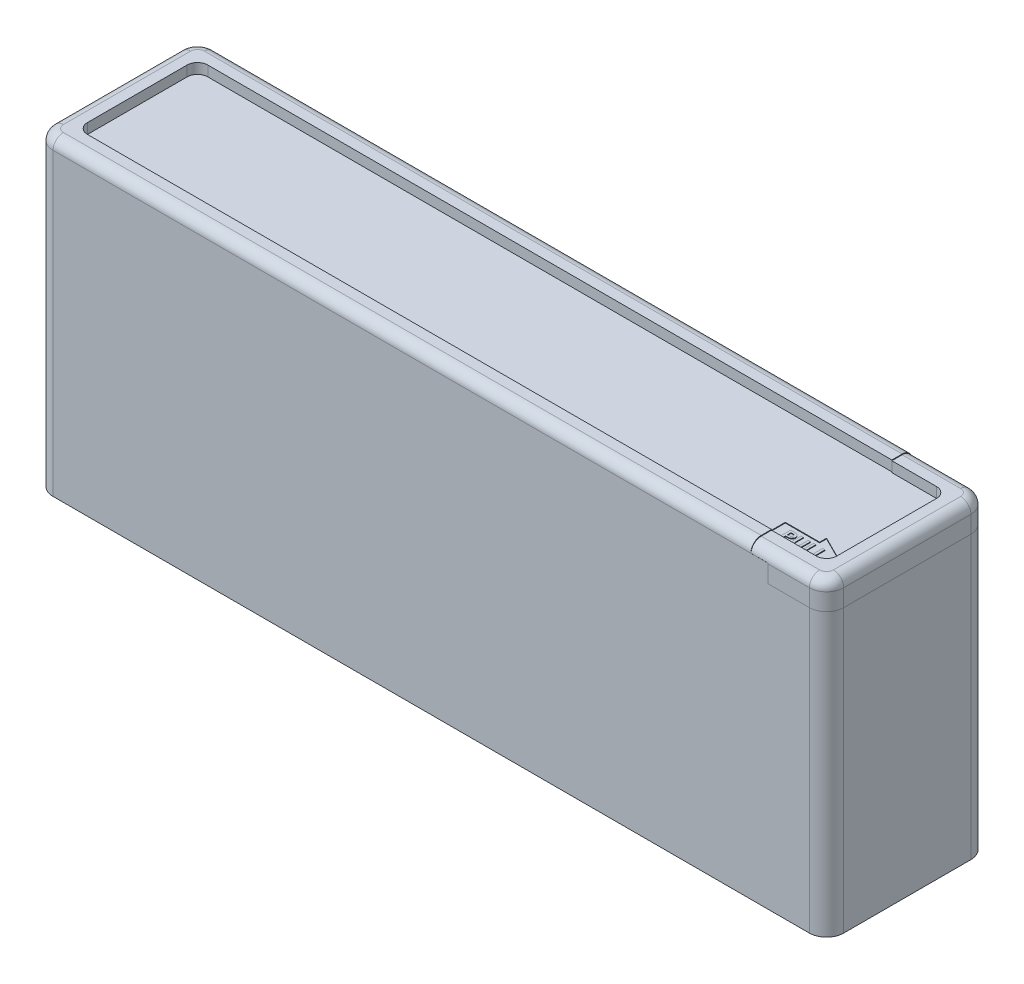
from build123d import *

# Parameters (mm, degrees)
SKETCH1_W              = 214
SKETCH1_H              = 47
SKETCH1_W_2            = 202
SKETCH1_H_2            = 35
BOSS_EXTRUDE1_DEPTH    = 5
SKETCH2_W              = 214
SKETCH2_H              = 47
BOSS_EXTRUDE2_DEPTH    = 2
BOSS_EXTRUDE3_DEPTH    = 202
SKETCH4_W              = 214
SKETCH4_H              = 47
SKETCH4_W_2            = 202
SKETCH4_H_2            = 35
BOSS_EXTRUDE4_DEPTH    = 45
SKETCH6_W              = 47
SKETCH6_H              = 52
BOSS_EXTRUDE5_DEPTH    = 16
SKETCH7_W              = 5
SKETCH7_H              = 41
CUT_EXTRUDE1_DEPTH     = 50.1
SKETCH8_W              = 41
SKETCH8_H              = 50
BOSS_EXTRUDE6_DEPTH    = 5
SKETCH9_W              = 41
SKETCH9_H              = 50.1
CUT_EXTRUDE2_DEPTH     = 14
SKETCH10_W             = 41
SKETCH10_H             = 50
BOSS_EXTRUDE7_DEPTH    = 3
SKETCH12_W             = 41
SKETCH12_H             = 50
SKETCH12_W_2           = 35
SKETCH12_H_2           = 44
BOSS_EXTRUDE8_DEPTH    = 11
CHAMFER1_SIZE          = 8
FILLET1_R              = 3
FILLET2_R              = 3
FILLET3_R              = 3
SKETCH15_R             = 1.1
CUT_EXTRUDE3_DEPTH     = 11
CUT_EXTRUDE4_DEPTH     = 2.2
SKETCH17_R             = 1
SKETCH17_R_2           = 1.1
CUT_EXTRUDE5_DEPTH     = 5
BOSS_EXTRUDE9_DEPTH    = 5.2
FILLET4_R              = 3
BOSS_EXTRUDE10_DEPTH   = 3
FILLET5_R              = 3
FILLET6_R              = 5
FILLET7_R              = 3
BOSS_EXTRUDE11_DEPTH   = 5
BOSS_EXTRUDE12_DEPTH   = 3
FILLET8_R              = 3
BOSS_EXTRUDE13_DEPTH   = 30
SKETCH24_R             = 6.05
CUT_EXTRUDE6_DEPTH     = 1.5
SKETCH25_W             = 80.4
SKETCH25_H             = 30.3
CUT_EXTRUDE7_DEPTH     = 25.1
CUT_EXTRUDE8_DEPTH     = 3
BOSS_EXTRUDE14_DEPTH   = 1
SKETCH28_R             = 7.5
CUT_EXTRUDE9_DEPTH     = 2
FILLET10_R             = 5
SKETCH29_W             = 65.3
SKETCH29_H             = 30.3
CUT_EXTRUDE10_DEPTH    = 15
SKETCH30_R             = 4.05
CUT_EXTRUDE11_DEPTH    = 2.8
SKETCH31_R             = 4.05
BOSS_EXTRUDE15_DEPTH   = 1
BOSS_EXTRUDE15_2_DEPTH = 1
SKETCH32_W             = 65.1
SKETCH32_H             = 30.1
BOSS_EXTRUDE16_DEPTH   = 15
SHELL1_T               = -3
SKETCH34_R             = 4.05
CUT_EXTRUDE12_DEPTH    = 2
CUT_EXTRUDE13_DEPTH    = 2
FILLET11_R             = 5
CUT_EXTRUDE14_DEPTH    = 0.2
BOSS_EXTRUDE17_DEPTH   = 0.2
BOSS_EXTRUDE18_DEPTH   = 2
SKETCH39_R             = 4
BOSS_EXTRUDE19_DEPTH   = 1.65
BOSS_EXTRUDE19_2_DEPTH = 1.65
SKETCH40_R             = 6
BOSS_EXTRUDE20_DEPTH   = 2.5
BOSS_EXTRUDE20_2_DEPTH = 2.5
BOSS_EXTRUDE20_3_DEPTH = 2.5
BOSS_EXTRUDE20_4_DEPTH = 2.5


# Some blends are built 0.0001 mm under size
with BuildPart() as part:
    # Sketch1 → Boss-Extrude1 (new body)
    with BuildSketch(Plane(origin=(0, 0, 0), x_dir=(1, 0, 0), z_dir=(0, 1, 0))):
        with Locations((101, 17.5)):
            Rectangle(SKETCH1_W, SKETCH1_H)
        with Locations((101, 17.5)):
            Rectangle(SKETCH1_W_2, SKETCH1_H_2, mode=Mode.SUBTRACT)
    extrude(amount=BOSS_EXTRUDE1_DEPTH)

    # Sketch2 → Boss-Extrude2 (add)
    with BuildSketch(Plane.XZ):
        with Locations((101, -17.5)):
            Rectangle(SKETCH2_W, SKETCH2_H)
    extrude(amount=BOSS_EXTRUDE2_DEPTH)

    # Sketch3 → Boss-Extrude3 (add)
    with BuildSketch(Plane(origin=(0, 0, 0), x_dir=(0, 0, -1), z_dir=(1, 0, 0))):
        with BuildLine():
            Line((13.5, 0), (21.5, 0))
            ThreePointArc((21.5, 0), (17.5, 1), (13.5, 0))
        make_face()
    extrude(amount=BOSS_EXTRUDE3_DEPTH)

    # Sketch4 → Boss-Extrude4 (add)
    with BuildSketch(Plane(origin=(0, 5, 0), x_dir=(1, 0, 0), z_dir=(0, 1, 0))):
        with Locations((101, 17.5)):
            Rectangle(SKETCH4_W, SKETCH4_H)
        with Locations((101, 17.5)):
            Rectangle(SKETCH4_W_2, SKETCH4_H_2, mode=Mode.SUBTRACT)
    extrude(amount=BOSS_EXTRUDE4_DEPTH)

    # Sketch6 → Boss-Extrude5 (add)
    with BuildSketch(Plane(origin=(208, 0, 0), x_dir=(0, 0, -1), z_dir=(1, 0, 0))):
        with Locations((17.5, 24)):
            Rectangle(SKETCH6_W, SKETCH6_H)
    extrude(amount=BOSS_EXTRUDE5_DEPTH)

    # Sketch7 → Cut-Extrude1 (cut)
    with BuildSketch(Plane(origin=(0, 50, 0), x_dir=(1, 0, 0), z_dir=(0, 1, 0))):
        with Locations((204.5, 17.5)):
            Rectangle(SKETCH7_W, SKETCH7_H)
    extrude(amount=-CUT_EXTRUDE1_DEPTH, mode=Mode.SUBTRACT)

    # Sketch9 → Cut-Extrude2 (cut)
    with BuildSketch(Plane.ZY.offset(-207)):
        with Locations((-17.5, 24.95)):
            Rectangle(SKETCH9_W, SKETCH9_H)
    extrude(amount=-CUT_EXTRUDE2_DEPTH, mode=Mode.SUBTRACT)

    # Fillet1
    fillet1_edges = [part.edges().sort_by_distance(p)[0] for p in [
        (221, 24.95, 3),
        (221, -0.1, -17.5),
        (221, 24.95, -38),
        (211.5, -0.1, 3),
        (211.5, -0.1, -38),
    ]]
    fillet(fillet1_edges, radius=FILLET1_R)

    # Sketch18 → Boss-Extrude9 (add)
    with BuildSketch(Plane(origin=(0, 50, 0), x_dir=(1, 0, 0), z_dir=(0, 1, 0))):
        Polygon((-6, -6), (207, -6), (207, -3.2), (-3.2, -3.2), (-3.2, 38.2), (207, 38.2), (207, 41), (-6, 41), align=None)
    extrude(amount=BOSS_EXTRUDE9_DEPTH)

    # Fillet4
    # the kernel refuses this fillet: 3 mm, written as the material it takes off along each edge
    with BuildSketch(Plane(origin=(207, 50, 3.2), x_dir=(-1, 0, 0), z_dir=(0, 1, 0))) as fillet4_piece_1:
        with BuildLine():
            CenterArc((2.993325909, 3), FILLET4_R, 183.822553729, 86.177446271)
            Line((0, 2.8), (-0.059866518, 2.796))
            ThreePointArc((-0.059866518, 2.796), (-0.06, 1.4), (-0.06, 0))
            Line((-0.06, 0), (0, -0.06))
            Line((0, -0.06), (2.993325909, -0.06))
            Line((2.993325909, -0.06), (2.993325909, 0))
        make_face()
    extrude(amount=12.683314774, mode=Mode.SUBTRACT)
    with BuildSketch(Plane(origin=(207, 50, -38.2), x_dir=(0, 0, -1), z_dir=(0, 1, 0))) as fillet4_piece_2:
        with BuildLine():
            CenterArc((3, 2.993325909), FILLET4_R, 180, 86.177446271)
            Line((0, 2.993325909), (-0.06, 2.993325909))
            Line((-0.06, 2.993325909), (-0.06, 0))
            Line((-0.06, 0), (0, -0.06))
            ThreePointArc((0, -0.06), (1.4, -0.06), (2.796, -0.059866518))
            Line((2.796, -0.059866518), (2.8, 0))
        make_face()
    extrude(amount=12.683314774, mode=Mode.SUBTRACT)

    # Sketch19 → Boss-Extrude10 (add)
    with BuildSketch(Plane(origin=(0, 55.2, 0), x_dir=(1, 0, 0), z_dir=(0, 1, 0))):
        Polygon((0, 0), (202, 0), (202, -6), (-6, -6), (-6, 41), (202, 41), (202, 35), (0, 35), align=None)
    extrude(amount=BOSS_EXTRUDE10_DEPTH)

    # Fillet5
    fillet5_edges = [part.edges().sort_by_distance(p)[0] for p in [
        (-3.2, 52.6, 3.2),
        (-3.2, 52.6, -38.2),
        (0, 56.7, 0),
        (0, 56.7, -35),
    ]]
    fillet(fillet5_edges, radius=FILLET5_R)

    # Fillet6
    fillet6_edges = [part.edges().sort_by_distance(p)[0] for p in [
        (224, 24, 6),
        (224, 24, -41),
        (-6, 28.1, -41),
        (-6, 28.1, 6),
    ]]
    fillet(fillet6_edges, radius=FILLET6_R)

    # Fillet7
    fillet7_edges = [part.edges().sort_by_distance(p)[0] for p in [
        (100.5, 58.2, -41),
        (-4.535533906, 58.2, -39.535533906),
        (-6, 58.2, -17.5),
        (-4.535533906, 58.2, 4.535533906),
        (100.5, 58.2, 6),
    ]]
    fillet(fillet7_edges, radius=FILLET7_R)

    # Sketch23 → Boss-Extrude13 (add)
    with BuildSketch(Plane.XZ.offset(2)):
        with BuildLine():
            Line((224, -36), (224, 1))
            ThreePointArc((224, 1), (222.535533906, 4.535533906), (219, 6))
            Line((219, 6), (-1, 6))
            ThreePointArc((-1, 6), (-4.535533906, 4.535533906), (-6, 1))
            Line((-6, 1), (-6, -36))
            ThreePointArc((-6, -36), (-4.535533906, -39.535533906), (-1, -41))
            Line((-1, -41), (219, -41))
            ThreePointArc((219, -41), (222.535533906, -39.535533906), (224, -36))
        make_face()
    extrude(amount=BOSS_EXTRUDE13_DEPTH)

    # Sketch24 → Cut-Extrude6 (cut)
    with BuildSketch(Plane.XZ.offset(32)):
        with Locations(Location((4, -4, 0), (0, 0, 270))):
            Circle(SKETCH24_R)
        with Locations(Location((4, -31, 0), (0, 0, 270))):
            Circle(SKETCH24_R)
        with Locations(Location((214, -31, 0), (0, 0, 270))):
            Circle(SKETCH24_R)
        with Locations(Location((214, -4, 0), (0, 0, 270))):
            Circle(SKETCH24_R)
    extrude(amount=-CUT_EXTRUDE6_DEPTH, mode=Mode.SUBTRACT)

    # Sketch25 → Cut-Extrude7 (cut)
    with BuildSketch(Plane.XZ.offset(32)):
        with Locations((74.2, -17.5)):
            Rectangle(SKETCH25_W, SKETCH25_H)
    extrude(amount=-CUT_EXTRUDE7_DEPTH, mode=Mode.SUBTRACT)

    # Sketch26 → Cut-Extrude8 (cut)
    with BuildSketch(Plane.XZ.offset(6.9)):
        with BuildLine():
            Line((76.75, -7.4), (71.65, -7.4))
            ThreePointArc((71.65, -7.4), (71.296446609, -7.546446609), (71.15, -7.9))
            Line((71.15, -7.9), (71.15, -27.1))
            ThreePointArc((71.15, -27.1), (71.296446609, -27.453553391), (71.65, -27.6))
            Line((71.65, -27.6), (76.75, -27.6))
            ThreePointArc((76.75, -27.6), (77.103553391, -27.453553391), (77.25, -27.1))
            Line((77.25, -27.1), (77.25, -7.9))
            ThreePointArc((77.25, -7.9), (77.103553391, -7.546446609), (76.75, -7.4))
        make_face()
    extrude(amount=-CUT_EXTRUDE8_DEPTH, mode=Mode.SUBTRACT)

    # Sketch28 → Cut-Extrude9 (cut)
    with BuildSketch(Plane.XZ.offset(32)):
        with Locations((36, -17.5)):
            Circle(SKETCH28_R)
        with Locations((112.4, -17.5)):
            Circle(SKETCH28_R)
    extrude(amount=-CUT_EXTRUDE9_DEPTH, mode=Mode.SUBTRACT)

    # Fillet10
    # the kernel refuses this fillet: 5 mm, written as the material it adds along each edge
    with BuildSketch(Plane(origin=(112.4, -30, -17.5), x_dir=(-0.8747262427675082, 0, 0.484617375063914), z_dir=(-0.484617375063914, 0, -0.8747262427675082))) as fillet10_piece_1_section:
        with BuildLine():
            CenterArc((3.5, -5), FILLET10_R, 36.869897646, 53.130102354)
            Line((3.5, 0), (3.5, 0.1))
            Line((3.5, 0.1), (7.5, 0.1))
            Line((7.5, 0.1), (7.6, 0))
            ThreePointArc((7.6, 0), (7.6, -1), (7.58, -1.94))
            Line((7.58, -1.94), (7.5, -2))
        make_face()
    fillet10_piece_1 = revolve(axis=Axis((112.4, -30, -17.5), (0, 1, 0)), revolution_arc=302.025186185, mode=Mode.PRIVATE)
    fillet10_piece_1 = split(fillet10_piece_1, bisect_by=Plane(origin=(114.4, -30, -17.5), z_dir=(1, 0, 0)), keep=Keep.TOP, mode=Mode.PRIVATE)
    add(fillet10_piece_1)
    with BuildSketch(Plane(origin=(36, -30, -17.5), x_dir=(0.8747262427675081, 0, 0.48461737506391406), z_dir=(0.48461737506391406, 0, -0.8747262427675081))) as fillet10_piece_2_section:
        with BuildLine():
            CenterArc((3.5, 5), FILLET10_R, 270, 53.130102354)
            Line((3.5, 0), (3.5, -0.1))
            Line((3.5, -0.1), (7.5, -0.1))
            Line((7.5, -0.1), (7.6, 0))
            ThreePointArc((7.6, 0), (7.6, 1), (7.58, 1.94))
            Line((7.58, 1.94), (7.5, 2))
        make_face()
    fillet10_piece_2 = revolve(axis=Axis((36, -30, -17.5), (0, -1, 0)), revolution_arc=302.025186185, mode=Mode.PRIVATE)
    fillet10_piece_2 = split(fillet10_piece_2, bisect_by=Plane(origin=(34, -30, -17.5), z_dir=(-1, 0, 0)), keep=Keep.TOP, mode=Mode.PRIVATE)
    add(fillet10_piece_2)

    # Sketch29 → Cut-Extrude10 (cut)
    with BuildSketch(Plane.XZ.offset(32)):
        with Locations((167.35, -17.5)):
            Rectangle(SKETCH29_W, SKETCH29_H)
    extrude(amount=-CUT_EXTRUDE10_DEPTH, mode=Mode.SUBTRACT)

    # Sketch30 → Cut-Extrude11 (cut)
    with BuildSketch(Plane.XZ.offset(17)):
        with Locations(Location((140.7, -17.5, 0), (0, 0, 270))):
            Circle(SKETCH30_R)
        with Locations(Location((194, -17.5, 0), (0, 0, 270))):
            Circle(SKETCH30_R)
    extrude(amount=-CUT_EXTRUDE11_DEPTH, mode=Mode.SUBTRACT)

    # Sketch35 → Cut-Extrude13 (cut)
    with BuildSketch(Plane.XZ.offset(32)):
        with BuildLine():
            Line((200, -24.728416147), (200, -10.271583853))
            ThreePointArc((200, -10.271583853), (205.5, -17.5), (200, -24.728416147))
        make_face()
        with BuildLine():
            Line((134.7, -10.271583853), (134.7, -24.728416147))
            ThreePointArc((134.7, -24.728416147), (129.2, -17.5), (134.7, -10.271583853))
        make_face()
    extrude(amount=-CUT_EXTRUDE13_DEPTH, mode=Mode.SUBTRACT)

    # Fillet11
    # the kernel refuses this fillet: 5 mm, written as the material it adds along each edge
    with BuildSketch(Plane(origin=(198, -30, -17.5), x_dir=(-0.8747262427675054, 0, 0.48461737506391894), z_dir=(-0.48461737506391894, 0, -0.8747262427675054))) as fillet11_piece_1_section:
        with BuildLine():
            CenterArc((3.5, -5), FILLET11_R, 36.869897646, 53.130102354)
            Line((3.5, 0), (3.5, 0.1))
            Line((3.5, 0.1), (7.5, 0.1))
            Line((7.5, 0.1), (7.6, 0))
            ThreePointArc((7.6, 0), (7.6, -1), (7.58, -1.94))
            Line((7.58, -1.94), (7.5, -2))
        make_face()
    fillet11_piece_1 = revolve(axis=Axis((198, -30, -17.5), (0, 1, 0)), revolution_arc=302.025186185, mode=Mode.PRIVATE)
    fillet11_piece_1 = split(fillet11_piece_1, bisect_by=Plane(origin=(200, -30, -17.5), z_dir=(1, 0, 0)), keep=Keep.TOP, mode=Mode.PRIVATE)
    add(fillet11_piece_1)
    with BuildSketch(Plane(origin=(136.7, -30, -17.5), x_dir=(0.8747262427675089, 0, -0.4846173750639128), z_dir=(0.4846173750639128, 0, 0.8747262427675089))) as fillet11_piece_2_section:
        with BuildLine():
            CenterArc((3.5, -5), FILLET11_R, 36.869897646, 53.130102354)
            Line((3.5, 0), (3.5, 0.1))
            Line((3.5, 0.1), (7.5, 0.1))
            Line((7.5, 0.1), (7.6, 0))
            ThreePointArc((7.6, 0), (7.6, -1), (7.58, -1.94))
            Line((7.58, -1.94), (7.5, -2))
        make_face()
    fillet11_piece_2 = revolve(axis=Axis((136.7, -30, -17.5), (0, 1, 0)), revolution_arc=302.025186185, mode=Mode.PRIVATE)
    fillet11_piece_2 = split(fillet11_piece_2, bisect_by=Plane(origin=(134.7, -30, -17.5), z_dir=(-1, 0, 0)), keep=Keep.TOP, mode=Mode.PRIVATE)
    add(fillet11_piece_2)


with BuildPart() as body_2:
    # Sketch8 → Boss-Extrude6 (new body)
    with BuildSketch(Plane.ZY.offset(-207)):
        with Locations((-17.5, 25)):
            Rectangle(SKETCH8_W, SKETCH8_H)
    extrude(amount=BOSS_EXTRUDE6_DEPTH)

    # Fillet3
    fillet3_edges = [body_2.edges().sort_by_distance(p)[0] for p in [
        (204.5, 0, 3),
        (204.5, 0, -38),
    ]]
    fillet(fillet3_edges, radius=FILLET3_R)

    # Sketch17 → Cut-Extrude5 (cut)
    with BuildSketch(Plane.ZY.offset(-202)):
        with Locations((-25.5, 45)):
            Circle(SKETCH17_R)
        with Locations(Location((-0.5, 46.5, 0), (0, 0, 180))):
            Circle(SKETCH17_R_2)
        with Locations((-34.5, 46.5)):
            Circle(SKETCH17_R_2)
        with Locations((-21.5, 45)):
            Circle(SKETCH17_R)
        with Locations((-17.5, 45)):
            Circle(SKETCH17_R)
        with Locations((-13.5, 45)):
            Circle(SKETCH17_R)
        with Locations((-9.5, 45)):
            Circle(SKETCH17_R)
        with Locations((-25.5, 41)):
            Circle(SKETCH17_R)
        with Locations((-21.5, 41)):
            Circle(SKETCH17_R)
        with Locations((-17.5, 41)):
            Circle(SKETCH17_R)
        with Locations((-13.5, 41)):
            Circle(SKETCH17_R)
        with Locations((-9.5, 41)):
            Circle(SKETCH17_R)
        with Locations((-25.5, 37)):
            Circle(SKETCH17_R)
        with Locations((-21.5, 37)):
            Circle(SKETCH17_R)
        with Locations((-17.5, 37)):
            Circle(SKETCH17_R)
        with Locations((-13.5, 37)):
            Circle(SKETCH17_R)
        with Locations((-9.5, 37)):
            Circle(SKETCH17_R)
        with Locations((-25.5, 33)):
            Circle(SKETCH17_R)
        with Locations((-21.5, 33)):
            Circle(SKETCH17_R)
        with Locations((-17.5, 33)):
            Circle(SKETCH17_R)
        with Locations((-13.5, 33)):
            Circle(SKETCH17_R)
        with Locations((-9.5, 33)):
            Circle(SKETCH17_R)
        with Locations((-25.5, 29)):
            Circle(SKETCH17_R)
        with Locations((-21.5, 29)):
            Circle(SKETCH17_R)
        with Locations((-17.5, 29)):
            Circle(SKETCH17_R)
        with Locations((-13.5, 29)):
            Circle(SKETCH17_R)
        with Locations((-9.5, 29)):
            Circle(SKETCH17_R)
        with Locations((-25.5, 25)):
            Circle(SKETCH17_R)
        with Locations((-21.5, 25)):
            Circle(SKETCH17_R)
        with Locations((-17.5, 25)):
            Circle(SKETCH17_R)
        with Locations((-13.5, 25)):
            Circle(SKETCH17_R)
        with Locations((-9.5, 25)):
            Circle(SKETCH17_R)
        with Locations((-25.5, 21)):
            Circle(SKETCH17_R)
        with Locations((-21.5, 21)):
            Circle(SKETCH17_R)
        with Locations((-17.5, 21)):
            Circle(SKETCH17_R)
        with Locations((-13.5, 21)):
            Circle(SKETCH17_R)
        with Locations((-9.5, 21)):
            Circle(SKETCH17_R)
        with Locations((-25.5, 17)):
            Circle(SKETCH17_R)
        with Locations((-21.5, 17)):
            Circle(SKETCH17_R)
        with Locations((-17.5, 17)):
            Circle(SKETCH17_R)
        with Locations((-13.5, 17)):
            Circle(SKETCH17_R)
        with Locations((-9.5, 17)):
            Circle(SKETCH17_R)
        with Locations((-25.5, 13)):
            Circle(SKETCH17_R)
        with Locations((-21.5, 13)):
            Circle(SKETCH17_R)
        with Locations((-17.5, 13)):
            Circle(SKETCH17_R)
        with Locations((-13.5, 13)):
            Circle(SKETCH17_R)
        with Locations((-9.5, 13)):
            Circle(SKETCH17_R)
        with Locations((-25.5, 9)):
            Circle(SKETCH17_R)
        with Locations((-21.5, 9)):
            Circle(SKETCH17_R)
        with Locations((-17.5, 9)):
            Circle(SKETCH17_R)
        with Locations((-13.5, 9)):
            Circle(SKETCH17_R)
        with Locations((-9.5, 9)):
            Circle(SKETCH17_R)
        with Locations((-25.5, 5)):
            Circle(SKETCH17_R)
        with Locations((-21.5, 5)):
            Circle(SKETCH17_R)
        with Locations((-17.5, 5)):
            Circle(SKETCH17_R)
        with Locations((-13.5, 5)):
            Circle(SKETCH17_R)
        with Locations((-9.5, 5)):
            Circle(SKETCH17_R)
        with Locations((-29.5, 41)):
            Circle(SKETCH17_R)
        with Locations((-29.5, 37)):
            Circle(SKETCH17_R)
        with Locations((-29.5, 33)):
            Circle(SKETCH17_R)
        with Locations((-29.5, 29)):
            Circle(SKETCH17_R)
        with Locations((-29.5, 25)):
            Circle(SKETCH17_R)
        with Locations((-29.5, 21)):
            Circle(SKETCH17_R)
        with Locations((-29.5, 17)):
            Circle(SKETCH17_R)
        with Locations((-29.5, 13)):
            Circle(SKETCH17_R)
        with Locations((-29.5, 9)):
            Circle(SKETCH17_R)
        with Locations((-33.5, 37)):
            Circle(SKETCH17_R)
        with Locations((-33.5, 33)):
            Circle(SKETCH17_R)
        with Locations((-33.5, 29)):
            Circle(SKETCH17_R)
        with Locations((-33.5, 25)):
            Circle(SKETCH17_R)
        with Locations((-33.5, 21)):
            Circle(SKETCH17_R)
        with Locations((-33.5, 17)):
            Circle(SKETCH17_R)
        with Locations((-33.5, 13)):
            Circle(SKETCH17_R)
        with Locations((-5.5, 41)):
            Circle(SKETCH17_R)
        with Locations((-5.5, 37)):
            Circle(SKETCH17_R)
        with Locations((-5.5, 33)):
            Circle(SKETCH17_R)
        with Locations((-5.5, 29)):
            Circle(SKETCH17_R)
        with Locations((-5.5, 25)):
            Circle(SKETCH17_R)
        with Locations((-5.5, 21)):
            Circle(SKETCH17_R)
        with Locations((-5.5, 17)):
            Circle(SKETCH17_R)
        with Locations((-5.5, 13)):
            Circle(SKETCH17_R)
        with Locations((-5.5, 9)):
            Circle(SKETCH17_R)
        with Locations((-1.5, 37)):
            Circle(SKETCH17_R)
        with Locations((-1.5, 33)):
            Circle(SKETCH17_R)
        with Locations((-1.5, 29)):
            Circle(SKETCH17_R)
        with Locations((-1.5, 25)):
            Circle(SKETCH17_R)
        with Locations((-1.5, 21)):
            Circle(SKETCH17_R)
        with Locations((-1.5, 17)):
            Circle(SKETCH17_R)
        with Locations((-1.5, 13)):
            Circle(SKETCH17_R)
        with Locations((-0.5, 3.5)):
            Circle(SKETCH17_R_2)
        with Locations(Location((-34.5, 3.5, 0), (0, 0, 180))):
            Circle(SKETCH17_R_2)
    extrude(amount=-CUT_EXTRUDE5_DEPTH, mode=Mode.SUBTRACT)


with BuildPart() as body_3:
    # Sketch10 → Boss-Extrude7 (new body)
    with BuildSketch(Plane.ZY.offset(-221)):
        with Locations((-17.5, 25)):
            Rectangle(SKETCH10_W, SKETCH10_H)
    extrude(amount=BOSS_EXTRUDE7_DEPTH)

    # Sketch12 → Boss-Extrude8 (add)
    with BuildSketch(Plane.ZY.offset(-218)):
        with Locations((-17.5, 25)):
            Rectangle(SKETCH12_W, SKETCH12_H)
        with Locations((-17.5, 25)):
            Rectangle(SKETCH12_W_2, SKETCH12_H_2, mode=Mode.SUBTRACT)
    extrude(amount=BOSS_EXTRUDE8_DEPTH)

    # Chamfer1
    chamfer1_edges = [body_3.edges().sort_by_distance(p)[0] for p in [
        (212.5, 47, -35),
        (212.5, 3, -35),
        (212.5, 3, 0),
        (212.5, 47, 0),
    ]]
    chamfer(chamfer1_edges, length=CHAMFER1_SIZE)

    # Fillet2
    fillet2_edges = [body_3.edges().sort_by_distance(p)[0] for p in [
        (221, 25, 3),
        (221, 0, -17.5),
        (221, 25, -38),
        (214, 0, 3),
        (214, 0, -38),
    ]]
    fillet(fillet2_edges, radius=FILLET2_R)

    # Sketch15 → Cut-Extrude3 (cut)
    with BuildSketch(Plane.ZY.offset(-207)):
        with Locations((-34.5, 46.5)):
            Circle(SKETCH15_R)
        with Locations(Location((-0.5, 46.5, 0), (0, 0, 180))):
            Circle(SKETCH15_R)
        with Locations((-0.5, 3.5)):
            Circle(SKETCH15_R)
        with Locations(Location((-34.5, 3.5, 0), (0, 0, 180))):
            Circle(SKETCH15_R)
    extrude(amount=-CUT_EXTRUDE3_DEPTH, mode=Mode.SUBTRACT)

    # Sketch16 → Cut-Extrude4 (cut)
    with BuildSketch(Plane.ZY.offset(-218)):
        Polygon((-32.826182009, 48.173817991), (-35.112659906, 48.786477897), (-36.786477897, 47.112659906), (-36.173817991, 44.826182009), (-33.887340094, 44.213522103), (-32.213522103, 45.887340094), align=None)
        Polygon((-2.173817991, 48.173817991), (0.112659906, 48.786477897), (1.786477897, 47.112659906), (1.173817991, 44.826182009), (-1.112659906, 44.213522103), (-2.786477897, 45.887340094), align=None)
        Polygon((1.786477897, 2.887340094), (1.173817991, 5.173817991), (-1.112659906, 5.786477897), (-2.786477897, 4.112659906), (-2.173817991, 1.826182009), (0.112659906, 1.213522103), align=None)
        Polygon((-33.887340094, 5.786477897), (-32.213522103, 4.112659906), (-32.826182009, 1.826182009), (-35.112659906, 1.213522103), (-36.786477897, 2.887340094), (-36.173817991, 5.173817991), align=None)
    extrude(amount=CUT_EXTRUDE4_DEPTH, mode=Mode.SUBTRACT)


with BuildPart() as body_4:
    # Sketch21 → Boss-Extrude11 (new body)
    with BuildSketch(Plane(origin=(0, 50, 0), x_dir=(1, 0, 0), z_dir=(0, 1, 0))):
        with BuildLine():
            Line((202, -3), (204.006674091, -3.2))
            ThreePointArc((204.006674091, -3.2), (206.056064244, -4.00910977), (207, -6))
            Line((207, -6), (219, -6))
            ThreePointArc((219, -6), (222.535533906, -4.535533906), (224, -1))
            Line((224, -1), (224, 36))
            ThreePointArc((224, 36), (222.535533906, 39.535533906), (219, 41))
            Line((219, 41), (207, 41))
            ThreePointArc((207, 41), (206.056064244, 39.00910977), (204.006674091, 38.2))
            Line((204.006674091, 38.2), (202, 38))
            Line((202, 38), (-0.2, 38.2))
            ThreePointArc((-0.2, 38.2), (-2.321320344, 37.321320344), (-3.2, 35.2))
            Line((-3.2, 35.2), (-3.2, -0.2))
            ThreePointArc((-3.2, -0.2), (-2.321320344, -2.321320344), (-0.2, -3.2))
            Line((-0.2, -3.2), (202, -3))
        make_face()
    extrude(amount=BOSS_EXTRUDE11_DEPTH)

    # Sketch36 → Cut-Extrude14 (cut)
    with BuildSketch(Plane(origin=(0, 55, 0), x_dir=(1, 0, 0), z_dir=(0, 1, 0))):
        Polygon((209, 1), (209, -1), (219, 4), (209, 9), (209, 7), (199, 7), (199, 4), (199, 1), align=None)
    extrude(amount=-CUT_EXTRUDE14_DEPTH, mode=Mode.SUBTRACT)

    # Sketch37 → Boss-Extrude17 (add)
    # profile 1 of 4: a face of its own
    with BuildSketch(Plane(origin=(0, 54.8, 0), x_dir=(1, 0, 0), z_dir=(0, 1, 0))):
        with BuildLine():
            add(Edge.make_bspline(
                [(204.299384764, 4.698602046), (204.298060321, 4.73563251), (204.295452968, 4.808532173), (204.281267248, 4.916132434), (204.255640882, 5.019299783), (204.221162309, 5.118720766), (204.176169112, 5.213661034), (204.120974044, 5.303966995), (204.056263771, 5.390532677), (203.981775277, 5.472238553), (203.89737555, 5.547728708), (203.802200666, 5.613898677), (203.69626001, 5.668996618), (203.58087596, 5.715353529), (203.455545392, 5.751931036), (203.320025831, 5.779011931), (203.174513058, 5.79732886), (203.073912734, 5.800931509), (203.022202601, 5.802783326)],
                knots=[0, 0, 0, 0, 0.937068904, 1.844751552, 2.739523149, 3.621801938, 4.502656074, 5.39177466, 6.29492876, 7.232794328, 8.184209359, 9.15364343, 10.156840052, 11.198548957, 12.294736057, 13.454503426, 14.69157515, 16, 16, 16, 16], degree=3))
            Line((203.022202601, 5.802783326), (201.772407828, 5.80350338))
            Line((201.772407828, 5.80350338), (201.772407828, 2.307827927))
            Line((201.772407828, 2.307827927), (202.458569982, 2.307827927))
            Line((202.458569982, 2.307827927), (202.458569982, 3.603750497))
            Line((202.458569982, 3.603750497), (203.02230255, 3.603750497))
            add(Edge.make_bspline(
                [(203.02230255, 3.603750497), (203.080249819, 3.606139744), (203.192001271, 3.610747412), (203.352304764, 3.633132198), (203.499494313, 3.663513809), (203.633070924, 3.703935158), (203.752763126, 3.755477588), (203.858879418, 3.816690206), (203.951734377, 3.88834115), (204.029313099, 3.970692221), (204.094806917, 4.057808145), (204.151395662, 4.146185457), (204.199299634, 4.23524466), (204.238872996, 4.32534861), (204.267356962, 4.417394054), (204.287944061, 4.510134813), (204.299185072, 4.604119591), (204.298838232, 4.667082514), (204.299384764, 4.698602046)],
                knots=[0, 0, 0, 0, 1.467802963, 2.830661649, 4.093056213, 5.270752255, 6.357966787, 7.385752986, 8.365399613, 9.316347213, 10.241090475, 11.122031212, 11.971247654, 12.799637499, 13.609684669, 14.406812627, 15.202941692, 16, 16, 16, 16], degree=3))
        make_face()
        with BuildLine():
            Line((202.458569982, 4.189006555), (202.458569982, 5.218247322))
            Line((202.458569982, 5.218247322), (203.02230255, 5.218247322))
            add(Edge.make_bspline(
                [(203.02230255, 5.218247322), (203.044389048, 5.217312959), (203.087261361, 5.215499258), (203.149447324, 5.208469391), (203.207531129, 5.196856319), (203.261529689, 5.181436964), (203.310979281, 5.160717189), (203.357051843, 5.137118358), (203.398789197, 5.108384089), (203.435826041, 5.074909772), (203.467859899, 5.037795494), (203.497609254, 4.999046326), (203.520870047, 4.955830701), (203.541566523, 4.910604066), (203.556557626, 4.861603947), (203.567157421, 4.809951377), (203.573898099, 4.755217653), (203.574641407, 4.717822735), (203.575023853, 4.698582338)],
                knots=[0, 0, 0, 0, 1.233589105, 2.39453164, 3.488494532, 4.536542106, 5.522626931, 6.476268881, 7.42100783, 8.341942605, 9.253950816, 10.155050632, 11.061521881, 11.98596425, 12.927462232, 13.913638223, 14.926527137, 16, 16, 16, 16], degree=3))
            add(Edge.make_bspline(
                [(203.575023853, 4.698582338), (203.574614909, 4.679825187), (203.57381022, 4.642916342), (203.567320371, 4.589101859), (203.556443044, 4.538216914), (203.541565442, 4.4901542), (203.520901196, 4.44561723), (203.497367455, 4.403074021), (203.468106871, 4.364438716), (203.435731383, 4.328088513), (203.399013567, 4.295092416), (203.356571264, 4.268243299), (203.311212196, 4.244089416), (203.261316258, 4.2246813), (203.207655722, 4.208639858), (203.149337799, 4.198396297), (203.087265814, 4.190771503), (203.044331496, 4.189606838), (203.022202601, 4.189006555)],
                knots=[0, 0, 0, 0, 1.055249109, 2.076436136, 3.044237745, 3.980557668, 4.900236266, 5.802359261, 6.710841354, 7.620228261, 8.539708117, 9.477100963, 10.438555643, 11.427650689, 12.484284413, 13.58463821, 14.755091789, 16, 16, 16, 16], degree=3))
            Line((203.022202601, 4.189006555), (202.458569982, 4.189006555))
        make_face(mode=Mode.SUBTRACT)
    # profile 2 of 4: a face of its own
    with BuildSketch(Plane(origin=(0, 54.8, 0), x_dir=(1, 0, 0), z_dir=(0, 1, 0))):
        with BuildLine():
            add(Edge.make_bspline(
                [(204.770760382, 3.629509847), (204.77291219, 3.573278924), (204.777077601, 3.464428656), (204.799072313, 3.30698567), (204.832569906, 3.160627292), (204.878625125, 3.025294936), (204.936581134, 2.901040178), (205.005782913, 2.787549761), (205.088046911, 2.685894301), (205.181412629, 2.595979401), (205.283206173, 2.516740825), (205.391544942, 2.44832435), (205.505479954, 2.389928747), (205.62548944, 2.343448829), (205.75084216, 2.306514387), (205.881678734, 2.279597637), (206.018516945, 2.264567175), (206.111575199, 2.262667196), (206.158940657, 2.26170013)],
                knots=[0, 0, 0, 0, 1.226870501, 2.374942052, 3.461863033, 4.497701463, 5.487104059, 6.447073287, 7.389967014, 8.331359375, 9.268584937, 10.19910481, 11.122572944, 12.056863339, 13.002099085, 13.970301696, 14.966909597, 16, 16, 16, 16], degree=3))
            add(Edge.make_bspline(
                [(206.158940657, 2.26170013), (206.20630564, 2.262673159), (206.299601779, 2.264589761), (206.437151819, 2.279643977), (206.569388028, 2.306639688), (206.696507991, 2.343281253), (206.818304041, 2.390082717), (206.934377133, 2.448435328), (207.045532065, 2.516869966), (207.150770986, 2.59590647), (207.247753786, 2.685567259), (207.332868348, 2.787459026), (207.405132266, 2.900729436), (207.465242621, 3.025079371), (207.512893195, 3.160455275), (207.546700663, 3.307030101), (207.570441098, 3.464169634), (207.575502906, 3.572910208), (207.578112816, 3.628977725)],
                knots=[0, 0, 0, 0, 1.023745615, 2.016500531, 2.986123881, 3.937764077, 4.873282816, 5.802306577, 6.742025132, 7.691381053, 8.643077932, 9.590628087, 10.552963976, 11.54012003, 12.569999019, 13.648277081, 14.787432686, 16, 16, 16, 16], degree=3))
            Line((207.578112816, 3.628977725), (207.578832869, 5.807827927))
            Line((207.578832869, 5.807827927), (206.892670716, 5.807827927))
            Line((206.892670716, 5.807827927), (206.892670716, 3.629509847))
            add(Edge.make_bspline(
                [(206.892670716, 3.629509847), (206.891643254, 3.599992506), (206.889656439, 3.542914501), (206.880022124, 3.460401099), (206.866280434, 3.383476643), (206.845010399, 3.312379021), (206.818579726, 3.246534217), (206.786008987, 3.186265333), (206.747627118, 3.131736825), (206.703377804, 3.083262455), (206.653739356, 3.040298631), (206.599212052, 3.002806736), (206.539163873, 2.971866225), (206.474985135, 2.945446317), (206.405125962, 2.926538978), (206.330972581, 2.912040537), (206.251647116, 2.903246909), (206.197163421, 2.902248565), (206.169031267, 2.901733079)],
                knots=[0, 0, 0, 0, 1.210035526, 2.339858902, 3.402048345, 4.408410616, 5.375716392, 6.305402709, 7.209711853, 8.101931337, 8.988427038, 9.895198932, 10.806929543, 11.752284526, 12.734264245, 13.767439652, 14.84723802, 16, 16, 16, 16], degree=3))
            add(Edge.make_bspline(
                [(206.169031267, 2.901733079), (206.141379158, 2.902253854), (206.087614094, 2.903266417), (206.009253896, 2.912061847), (205.936016312, 2.92641087), (205.867190648, 2.94559458), (205.803923748, 2.971851364), (205.744598559, 3.002822304), (205.690785544, 3.040308093), (205.641873382, 3.083285594), (205.598341289, 3.131765584), (205.560703167, 3.186304963), (205.528802084, 3.246558561), (205.503310073, 3.312535351), (205.48179699, 3.383455453), (205.468234166, 3.460410615), (205.458157294, 3.54270249), (205.457342525, 3.599632179), (205.456922535, 3.628977725)],
                knots=[0, 0, 0, 0, 1.141646635, 2.219747714, 3.250996846, 4.221314193, 5.164626549, 6.074475516, 6.979932326, 7.865660519, 8.757976613, 9.663433423, 10.595460791, 11.566386615, 12.580357606, 13.650577857, 14.788943395, 16, 16, 16, 16], degree=3))
            Line((205.456922535, 3.628977725), (205.456922535, 5.807827927))
            Line((205.456922535, 5.807827927), (204.770760382, 5.807827927))
            Line((204.770760382, 5.807827927), (204.770760382, 3.629509847))
        make_face()
    # profile 3 of 4: a face of its own
    with BuildSketch(Plane(origin=(0, 54.8, 0), x_dir=(1, 0, 0), z_dir=(0, 1, 0))):
        Polygon((208.414911947, 5.807827927), (208.414911947, 2.307828631), (210.476094211, 2.307828631), (210.476094211, 2.901733079), (209.101074101, 2.901733079), (209.101074101, 5.807827927), align=None)
    # profile 4 of 4: a face of its own
    with BuildSketch(Plane(origin=(0, 54.8, 0), x_dir=(1, 0, 0), z_dir=(0, 1, 0))):
        Polygon((211.044236494, 5.807827927), (211.044236494, 2.307828631), (213.105418758, 2.307828631), (213.105418758, 2.901733079), (211.730398647, 2.901733079), (211.730398647, 5.807827927), align=None)
    extrude(amount=BOSS_EXTRUDE17_DEPTH)


with BuildPart() as body_5:
    # Sketch22 → Boss-Extrude12 (new body)
    with BuildSketch(Plane(origin=(0, 55, 0), x_dir=(1, 0, 0), z_dir=(0, 1, 0))):
        with BuildLine():
            Line((202, -6), (219, -6))
            ThreePointArc((219, -6), (222.535533906, -4.535533906), (224, -1))
            Line((224, -1), (224, 36))
            ThreePointArc((224, 36), (222.535533906, 39.535533906), (219, 41))
            Line((219, 41), (202, 41))
            Line((202, 41), (202, 35))
            Line((202, 35), (215, 35))
            ThreePointArc((215, 35), (217.121320344, 34.121320344), (218, 32))
            Line((218, 32), (218, 3))
            ThreePointArc((218, 3), (217.121320344, 0.878679656), (215, 0))
            Line((215, 0), (202, 0))
            Line((202, 0), (202, -6))
        make_face()
    extrude(amount=BOSS_EXTRUDE12_DEPTH)

    # Fillet8
    fillet8_edges = [body_5.edges().sort_by_distance(p)[0] for p in [
        (210.5, 58, -41),
        (222.535533906, 58, -39.535533906),
        (224, 58, -17.5),
        (222.535533906, 58, 4.535533906),
        (210.5, 58, 6),
    ]]
    fillet(fillet8_edges, radius=FILLET8_R - 0.0001)  # a hair under: the kernel refuses the full size


with BuildPart() as body_6:
    # Sketch27 → Boss-Extrude14 (new body)
    with BuildSketch(Plane.XZ.offset(6.9)):
        with BuildLine():
            Line((77.25, -27.1), (77.25, -7.9))
            ThreePointArc((77.25, -7.9), (77.103553391, -7.546446609), (76.75, -7.4))
            Line((76.75, -7.4), (71.65, -7.4))
            ThreePointArc((71.65, -7.4), (71.296446609, -7.546446609), (71.15, -7.9))
            Line((71.15, -7.9), (71.15, -27.1))
            ThreePointArc((71.15, -27.1), (71.296446609, -27.453553391), (71.65, -27.6))
            Line((71.65, -27.6), (76.75, -27.6))
            ThreePointArc((76.75, -27.6), (77.103553391, -27.453553391), (77.25, -27.1))
        make_face()
    extrude(amount=-BOSS_EXTRUDE14_DEPTH)


with BuildPart() as body_7:
    # Sketch31 → Boss-Extrude15 (new body)
    with BuildSketch(Plane.XZ.offset(17)):
        with Locations(Location((194, -17.5, 0), (0, 0, 270))):
            Circle(SKETCH31_R)
    extrude(amount=-BOSS_EXTRUDE15_DEPTH)


with BuildPart() as body_8:
    # Sketch31 → Boss-Extrude15 2 (new body)
    with BuildSketch(Plane.XZ.offset(17)):
        with Locations(Location((140.7, -17.5, 0), (0, 0, 270))):
            Circle(SKETCH31_R)
    extrude(amount=-BOSS_EXTRUDE15_2_DEPTH)


with BuildPart() as body_9:
    # Sketch32 → Boss-Extrude16 (new body)
    with BuildSketch(Plane.XZ.offset(17)):
        with Locations((167.35, -17.5)):
            Rectangle(SKETCH32_W, SKETCH32_H)
    extrude(amount=BOSS_EXTRUDE16_DEPTH)

    # Shell1
    shell1_openings = [body_9.faces().sort_by_distance(p)[0] for p in [
        (134.8, -24.5, -17.5),
    ]]
    offset(amount=SHELL1_T, openings=shell1_openings, kind=Kind.INTERSECTION)

    # Sketch34 → Cut-Extrude12 (cut)
    with BuildSketch(Plane.XZ.offset(20)):
        with Locations(Location((140.7, -17.5, 0), (0, 0, 270))):
            Circle(SKETCH34_R)
        with Locations(Location((194, -17.5, 0), (0, 0, 270))):
            Circle(SKETCH34_R)
    extrude(amount=-CUT_EXTRUDE12_DEPTH, mode=Mode.SUBTRACT)


with BuildPart() as body_10:
    # Sketch38 → Boss-Extrude18 (new body)
    with BuildSketch(Plane.XZ.offset(3.9)):
        with BuildLine():
            Line((72.2, -27.5), (76.2, -27.5))
            ThreePointArc((76.2, -27.5), (76.907106781, -27.207106781), (77.2, -26.5))
            Line((77.2, -26.5), (77.2, -8.5))
            ThreePointArc((77.2, -8.5), (76.907106781, -7.792893219), (76.2, -7.5))
            Line((76.2, -7.5), (72.2, -7.5))
            ThreePointArc((72.2, -7.5), (71.492893219, -7.792893219), (71.2, -8.5))
            Line((71.2, -8.5), (71.2, -26.5))
            ThreePointArc((71.2, -26.5), (71.492893219, -27.207106781), (72.2, -27.5))
        make_face()
    extrude(amount=BOSS_EXTRUDE18_DEPTH)


with BuildPart() as body_11:
    # Sketch39 → Boss-Extrude19 (new body)
    with BuildSketch(Plane.XZ.offset(14.2)):
        with Locations(Location((140.7, -17.5, 0), (0, 0, 270))):
            Circle(SKETCH39_R)
    extrude(amount=BOSS_EXTRUDE19_DEPTH)


with BuildPart() as body_12:
    # Sketch39 → Boss-Extrude19 2 (new body)
    with BuildSketch(Plane.XZ.offset(14.2)):
        with Locations(Location((194, -17.5, 0), (0, 0, 270))):
            Circle(SKETCH39_R)
    extrude(amount=BOSS_EXTRUDE19_2_DEPTH)


with BuildPart() as body_13:
    # Sketch40 → Boss-Extrude20 (new body)
    with BuildSketch(Plane.XZ.offset(30.5)):
        with Locations(Location((4, -4, 0), (0, 0, 270))):
            Circle(SKETCH40_R)
    extrude(amount=BOSS_EXTRUDE20_DEPTH)


with BuildPart() as body_14:
    # Sketch40 → Boss-Extrude20 2 (new body)
    with BuildSketch(Plane.XZ.offset(30.5)):
        with Locations(Location((4, -31, 0), (0, 0, 270))):
            Circle(SKETCH40_R)
    extrude(amount=BOSS_EXTRUDE20_2_DEPTH)


with BuildPart() as body_15:
    # Sketch40 → Boss-Extrude20 3 (new body)
    with BuildSketch(Plane.XZ.offset(30.5)):
        with Locations(Location((214, -31, 0), (0, 0, 270))):
            Circle(SKETCH40_R)
    extrude(amount=BOSS_EXTRUDE20_3_DEPTH)


with BuildPart() as body_16:
    # Sketch40 → Boss-Extrude20 4 (new body)
    with BuildSketch(Plane.XZ.offset(30.5)):
        with Locations(Location((214, -4, 0), (0, 0, 270))):
            Circle(SKETCH40_R)
    extrude(amount=BOSS_EXTRUDE20_4_DEPTH)


solid = Compound([part.part, body_2.part, body_3.part, body_4.part, body_5.part, body_6.part, body_7.part, body_8.part, body_9.part, body_10.part, body_11.part, body_12.part, body_13.part, body_14.part, body_15.part, body_16.part])
